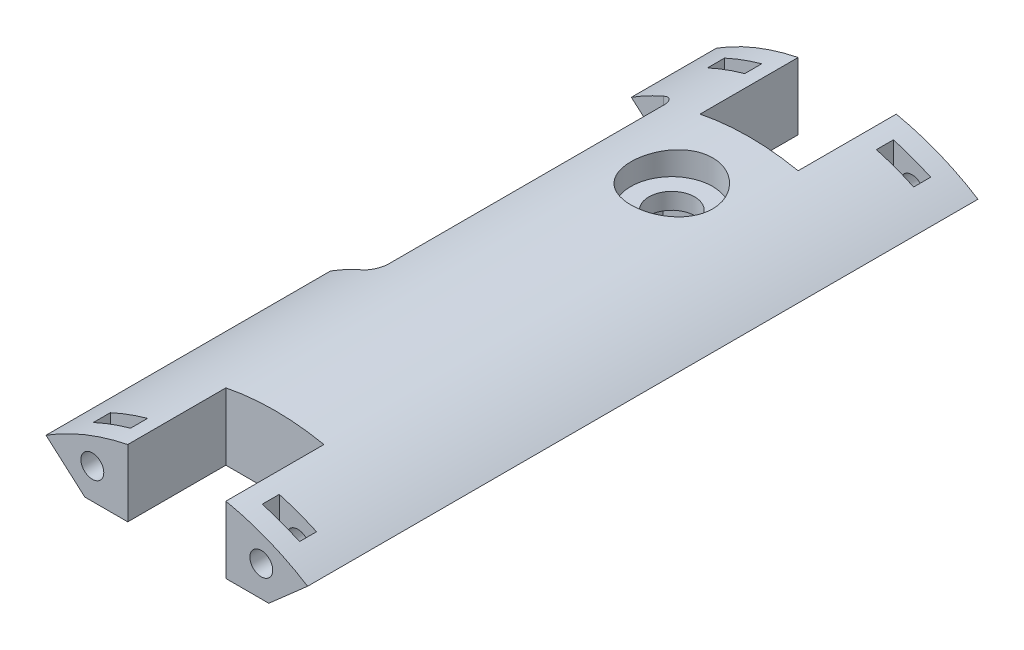
from build123d import *

# Parameters (mm, degrees)
BOSS_EXTRU_2_DEPTH       = 102.5
ESQUISSE7_R              = 1.75
ENL_V_MAT_EXTRU_4_DEPTH  = 12
ENL_V_START              = -5.6
ENL_V_MAT_EXTRU_5_DEPTH  = 2.6
ENL_V_START_2            = -12
ESQUISSE12_R             = 1.75
ENL_V_MAT_EXTRU_6_DEPTH  = 12
ENL_V_START_3            = -3
ENL_V_MAT_EXTRU_7_DEPTH  = 2.6
ENL_V_START_4            = -21
ESQUISSE18_W             = 14.3
ESQUISSE18_H             = 4.7
ENL_V_MAT_EXTRU_11_DEPTH = 11.74
ESQUISSE19_R             = 3.5
ENL_V_MAT_EXTRU_12_DEPTH = 105.622846453
ENL_V_START_5            = -2.5
ESQUISSE20_R             = 6.25
ENL_V_MAT_EXTRU_13_DEPTH = 103.122846576
ESQUISSE21_W             = 15
ESQUISSE21_H             = 15
ENL_V_MAT_EXTRU_14_DEPTH = 106.010713866
ESQUISSE22_W             = 2.25
ESQUISSE22_H             = 15.5
ENL_V_MAT_EXTRU_15_DEPTH = 9.125
CHANFREIN1_SIZE          = 9.125
CONG_1_R                 = 4
ESQUISSE23_W             = 6.93763889
ESQUISSE23_H             = 46
ENL_V_MAT_EXTRU_16_DEPTH = 106.010713866
CONG_2_R                 = 2


with BuildPart() as part:
    # Esquisse3 → Boss.-Extru.2 (new body)
    with BuildSketch(Plane.XY):
        with BuildLine():
            ThreePointArc((-20, 31.721443851), (0, 37.5), (20, 31.721443851))
            Line((20, 31.721443851), (14.06236111, 26.5))
            Line((14.06236111, 26.5), (-14.06236111, 26.5))
            Line((-14.06236111, 26.5), (-20, 31.721443851))
        make_face()
    extrude(amount=BOSS_EXTRU_2_DEPTH)

    # Esquisse7 → Enlèv. mat.-Extru.4 (cut)
    with BuildSketch(Plane.XY.offset(102.5)):
        with Locations((-12.915565842, 31.180934222)):
            Circle(ESQUISSE7_R)
        with Locations((12.915565842, 31.180934222)):
            Circle(ESQUISSE7_R)
    extrude(amount=-ENL_V_MAT_EXTRU_4_DEPTH, mode=Mode.SUBTRACT)

    # Esquisse11 → Enlèv. mat.-Extru.5 (cut)
    with BuildSketch(Plane.XY.offset(102.5).offset(ENL_V_START)):
        with BuildLine():
            Line((-15.765565842, 31.180934222), (-15.765565842, 34.024945756))
            ThreePointArc((-15.765565842, 34.024945756), (-12.95813326, 35.190009696), (-10.065565842, 36.123875543))
            Line((-10.065565842, 36.123875543), (-10.065565842, 29.426382489))
            Line((-10.065565842, 29.426382489), (-12.915565842, 27.780934222))
            Line((-12.915565842, 27.780934222), (-15.765565842, 29.426382489))
            Line((-15.765565842, 29.426382489), (-15.765565842, 31.180934222))
        make_face()
        with BuildLine():
            Line((10.065565842, 36.123875543), (10.065565842, 29.426382489))
            Line((10.065565842, 29.426382489), (12.915565842, 27.780934222))
            Line((12.915565842, 27.780934222), (15.765565842, 29.426382489))
            Line((15.765565842, 29.426382489), (15.765565842, 34.024945756))
            ThreePointArc((15.765565842, 34.024945756), (12.95813326, 35.190009696), (10.065565842, 36.123875543))
        make_face()
    extrude(amount=ENL_V_MAT_EXTRU_5_DEPTH, mode=Mode.SUBTRACT)

    # Esquisse12 → Enlèv. mat.-Extru.6 (cut)
    with BuildSketch(Plane(origin=(0, 0, 0), x_dir=(-1, 0, 0), z_dir=(0, 0, -1)).offset(ENL_V_START_2)):
        with Locations(Location((-12.915565842, 31.180934222, 0), (0, 0, 180))):
            Circle(ESQUISSE12_R)
        with Locations(Location((12.915565842, 31.180934222, 0), (0, 0, 180))):
            Circle(ESQUISSE12_R)
    extrude(amount=ENL_V_MAT_EXTRU_6_DEPTH, mode=Mode.SUBTRACT)

    # Esquisse14 → Enlèv. mat.-Extru.7 (cut)
    with BuildSketch(Plane(origin=(0, 0, 0), x_dir=(-1, 0, 0), z_dir=(0, 0, -1)).offset(ENL_V_START_3)):
        with BuildLine():
            Line((-15.765565842, 31.180934222), (-15.765565842, 34.024945756))
            ThreePointArc((-15.765565842, 34.024945756), (-12.95813326, 35.190009696), (-10.065565842, 36.123875543))
            Line((-10.065565842, 36.123875543), (-10.065565842, 29.426382489))
            Line((-10.065565842, 29.426382489), (-12.915565842, 27.780934222))
            Line((-12.915565842, 27.780934222), (-15.765565842, 29.426382489))
            Line((-15.765565842, 29.426382489), (-15.765565842, 31.180934222))
        make_face()
        with BuildLine():
            Line((10.065565842, 36.123875543), (10.065565842, 29.426382489))
            Line((10.065565842, 29.426382489), (12.915565842, 27.780934222))
            Line((12.915565842, 27.780934222), (15.765565842, 29.426382489))
            Line((15.765565842, 29.426382489), (15.765565842, 34.024945756))
            ThreePointArc((15.765565842, 34.024945756), (12.95813326, 35.190009696), (10.065565842, 36.123875543))
        make_face()
    extrude(amount=-ENL_V_MAT_EXTRU_7_DEPTH, mode=Mode.SUBTRACT)

    # Esquisse18 → Enlèv. mat.-Extru.11 (cut)
    with BuildSketch(Plane(origin=(0, 0, 0), x_dir=(-1, 0, 0), z_dir=(0, 0, -1)).offset(ENL_V_START_4)):
        with Locations((0, 28.85)):
            Rectangle(ESQUISSE18_W, ESQUISSE18_H)
    extrude(amount=-ENL_V_MAT_EXTRU_11_DEPTH, mode=Mode.SUBTRACT)

    # Esquisse19 → Enlèv. mat.-Extru.12 (cut, through all)
    with BuildSketch(Plane(origin=(0, 31.2, 0), x_dir=(-1, 0, 0), z_dir=(0, -1, 0))):
        with Locations(Location((0, -26.82, 0), (0, 0, 90))):
            Circle(ESQUISSE19_R)
    extrude(amount=-ENL_V_MAT_EXTRU_12_DEPTH, mode=Mode.SUBTRACT)

    # Esquisse20 → Enlèv. mat.-Extru.13 (cut, through all)
    with BuildSketch(Plane(origin=(0, 31.2, 0), x_dir=(-1, 0, 0), z_dir=(0, -1, 0)).offset(ENL_V_START_5)):
        with Locations(Location((0, -26.82, 0), (0, 0, 90))):
            Circle(ESQUISSE20_R)
    extrude(amount=-ENL_V_MAT_EXTRU_13_DEPTH, mode=Mode.SUBTRACT)

    # Esquisse21 → Enlèv. mat.-Extru.14 (cut, through all)
    with BuildSketch(Plane.XZ.offset(-26.5)):
        with Locations((0, 95)):
            Rectangle(ESQUISSE21_W, ESQUISSE21_H)
        with Locations((0, 7.5)):
            Rectangle(ESQUISSE21_W, ESQUISSE21_H)
    extrude(amount=-ENL_V_MAT_EXTRU_14_DEPTH, mode=Mode.SUBTRACT)

    # Esquisse22 → Enlèv. mat.-Extru.15 (cut)
    with BuildSketch(Plane(origin=(0, 26.5, 0), x_dir=(-1, 0, 0), z_dir=(0, -1, 0))):
        with Locations((-9.45, -82.5)):
            Rectangle(ESQUISSE22_W, ESQUISSE22_H)
    extrude(amount=-ENL_V_MAT_EXTRU_15_DEPTH, mode=Mode.SUBTRACT)

    # Chanfrein1
    # the kernel refuses this chamfer: 9.125 mm, written as the material it adds along each edge
    with BuildSketch(Plane(origin=(8.325, 35.625, 90.25), x_dir=(0, -0.9996219169112966, 0.027495876610586712), z_dir=(1, 0, 0)), Plane(origin=(10.575, 35.625, 74.75), x_dir=(0, -0.9996219169112966, -0.027495876610586712), z_dir=(-1, 0, 0))) as chanfrein1_piece_1:
        Polygon((CHANFREIN1_SIZE * 0.999621916911, CHANFREIN1_SIZE * 0.0274958766106), (-CHANFREIN1_SIZE * 0.0274958766106, CHANFREIN1_SIZE * 0.999621916911), (0, 0), align=None)
    extrude(amount=2.25)

    # Congé1
    cong_1_edges = [part.edges().sort_by_distance(p)[0] for p in [
        (9.45, 34.25, 82.5),
    ]]
    fillet(cong_1_edges, radius=CONG_1_R)

    # Esquisse23 → Enlèv. mat.-Extru.16 (cut, through all)
    with BuildSketch(Plane(origin=(0, 26.5, 0), x_dir=(-1, 0, 0), z_dir=(0, -1, 0))):
        with Locations((16.531180555, -36)):
            Rectangle(ESQUISSE23_W, ESQUISSE23_H)
    extrude(amount=-ENL_V_MAT_EXTRU_16_DEPTH, mode=Mode.SUBTRACT)

    # Congé2
    cong_2_edges = [part.edges().sort_by_distance(p)[0] for p in [
        (-13.06236111, 30.825727028, 59),
        (-13.06236111, 30.825727028, 13),
    ]]
    fillet(cong_2_edges, radius=CONG_2_R)


solid = part.part
